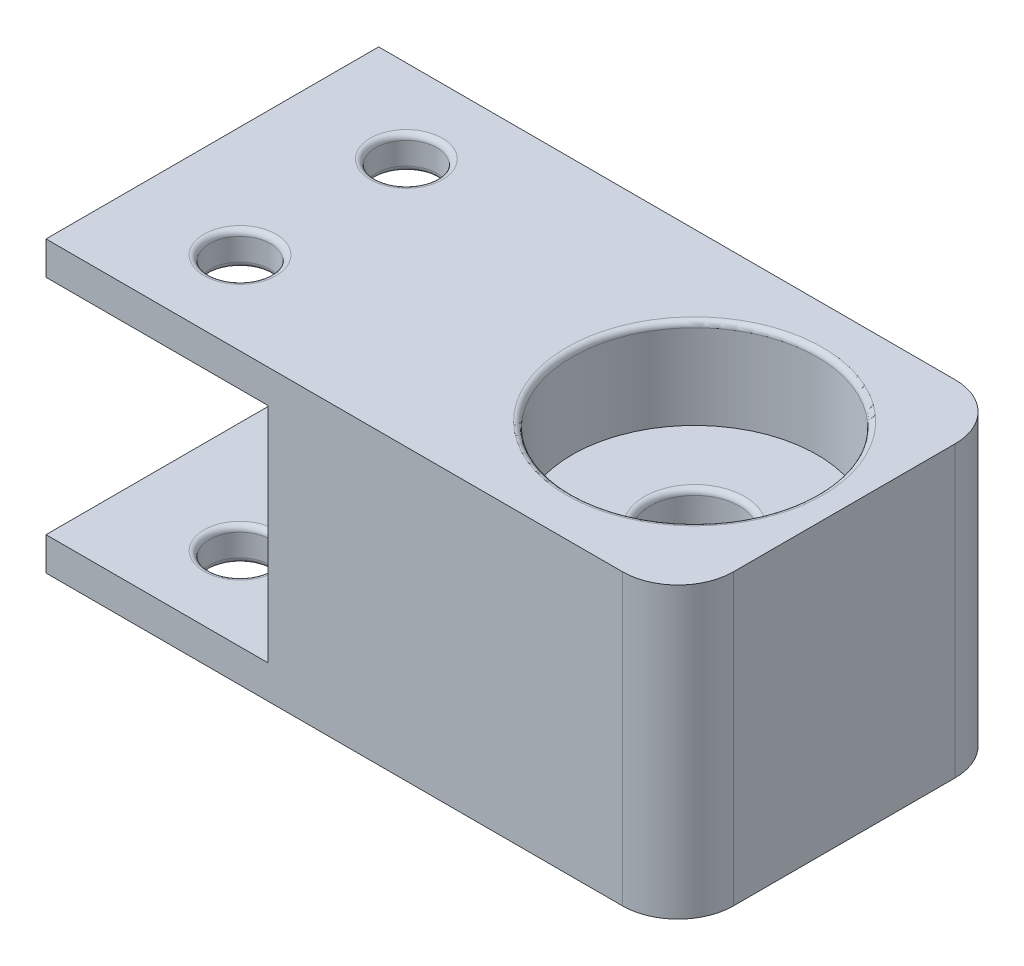
from build123d import *

# Parameters (mm, degrees)
SKETCH4_W           = 57
SKETCH4_H           = 30
BOSS_EXTRUDE2_DEPTH = 3
SKETCH5_W           = 37
SKETCH5_H           = 30
BOSS_EXTRUDE3_DEPTH = 20.1
BOSS_EXTRUDE4_DEPTH = 3
SKETCH7_R           = 2.75
CUT_EXTRUDE3_DEPTH  = 42.4543122
FILLET5_R           = 0.5
SKETCH8_R           = 11.049
CUT_EXTRUDE4_DEPTH  = 8.128
FILLET6_R           = 5
CUT_EXTRUDE5_START  = -8.128
SKETCH11_R          = 11.049
CUT_EXTRUDE5_DEPTH  = 8.128
SKETCH12_R          = 4.025
CUT_EXTRUDE6_DEPTH  = 37.881469385
FILLET7_R           = 0.5


with BuildPart() as part:
    # Sketch4 → Boss-Extrude2 (new body)
    with BuildSketch(Plane(origin=(0, 0, 0), x_dir=(1, 0, 0), z_dir=(0, 1, 0))):
        Rectangle(SKETCH4_W, SKETCH4_H)
    extrude(amount=BOSS_EXTRUDE2_DEPTH)

    # Sketch5 → Boss-Extrude3 (add)
    with BuildSketch(Plane(origin=(0, 3, 0), x_dir=(1, 0, 0), z_dir=(0, 1, 0))):
        with Locations((10, 0)):
            Rectangle(SKETCH5_W, SKETCH5_H)
    extrude(amount=BOSS_EXTRUDE3_DEPTH)

    # Sketch6 → Boss-Extrude4 (add)
    with BuildSketch(Plane(origin=(0, 23.1, 0), x_dir=(1, 0, 0), z_dir=(0, 1, 0))):
        Polygon((28.5, -15), (28.5, 15), (-8.5, 15), (-28.5, 15), (-28.5, -15), (-8.5, -15), align=None)
    extrude(amount=BOSS_EXTRUDE4_DEPTH)

    # Sketch7 → Cut-Extrude3 (cut, through all)
    with BuildSketch(Plane(origin=(0, 26.1, 0), x_dir=(1, 0, 0), z_dir=(0, 1, 0))):
        with Locations((-18.5, -7.5)):
            Circle(SKETCH7_R)
        with Locations((-18.5, 7.5)):
            Circle(SKETCH7_R)
    extrude(amount=-CUT_EXTRUDE3_DEPTH, mode=Mode.SUBTRACT)

    # Fillet5
    fillet5_edges = [part.edges().sort_by_distance(p)[0] for p in [
        (-21.25, 3, -7.5),
        (-21.25, 0, -7.5),
        (-21.25, 3, 7.5),
        (-21.25, 0, 7.5),
        (-21.25, 23.1, -7.5),
        (-21.25, 26.1, -7.5),
        (-21.25, 23.1, 7.5),
        (-21.25, 26.1, 7.5),
    ]]
    fillet(fillet5_edges, radius=FILLET5_R)

    # Sketch8 → Cut-Extrude4 (cut)
    with BuildSketch(Plane(origin=(0, 26.1, 0), x_dir=(1, 0, 0), z_dir=(0, 1, 0))):
        with Locations((15, 0)):
            Circle(SKETCH8_R)
    extrude(amount=-CUT_EXTRUDE4_DEPTH, mode=Mode.SUBTRACT)

    # Fillet6
    fillet6_edges = [part.edges().sort_by_distance(p)[0] for p in [
        (28.5, 13.05, -15),
        (28.5, 13.05, 15),
    ]]
    fillet(fillet6_edges, radius=FILLET6_R)

    # Sketch11 → Cut-Extrude5 (cut)
    with BuildSketch(Plane.XZ.offset(CUT_EXTRUDE5_START)):
        with Locations((15, 0)):
            Circle(SKETCH11_R)
    extrude(amount=CUT_EXTRUDE5_DEPTH, mode=Mode.SUBTRACT)

    # Sketch12 → Cut-Extrude6 (cut, through all)
    with BuildSketch(Plane.XZ.offset(-8.128)):
        with Locations((15, 0)):
            Circle(SKETCH12_R)
    extrude(amount=-CUT_EXTRUDE6_DEPTH, mode=Mode.SUBTRACT)

    # Fillet7
    fillet7_edges = [part.edges().sort_by_distance(p)[0] for p in [
        (3.951, 26.1, 0),
        (10.975, 8.128, 0),
        (10.975, 17.972, 0),
        (3.951, 0, 0),
    ]]
    fillet(fillet7_edges, radius=FILLET7_R)


solid = part.part
